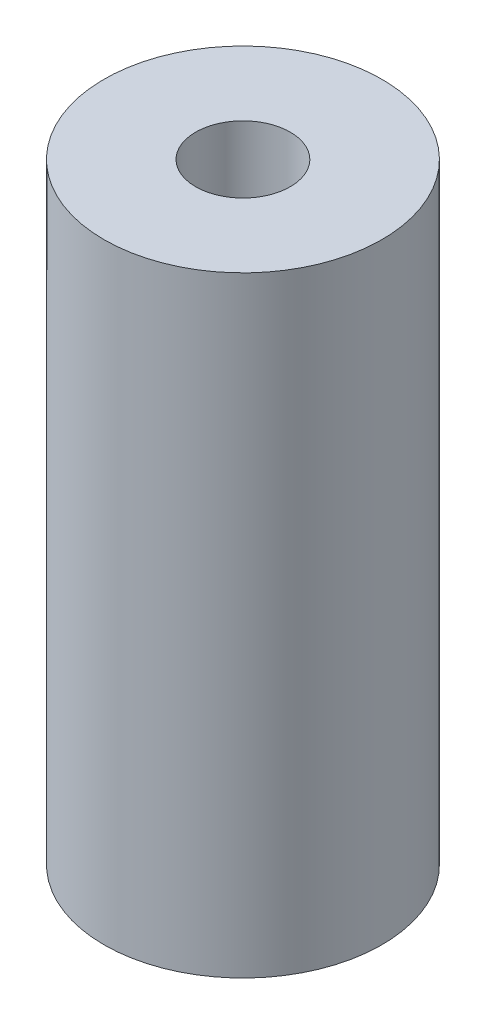
from build123d import *

# Parameters (mm, degrees)
SKETCH1_R           = 4.55
SKETCH1_R_2         = 1.55
BOSS_EXTRUDE1_DEPTH = 20


with BuildPart() as part:
    # Sketch1 → Boss-Extrude1 (new body)
    with BuildSketch(Plane(origin=(0, 0, 0), x_dir=(1, 0, 0), z_dir=(0, 1, 0))):
        Circle(SKETCH1_R)
        Circle(SKETCH1_R_2, mode=Mode.SUBTRACT)
    extrude(amount=BOSS_EXTRUDE1_DEPTH)


solid = part.part
